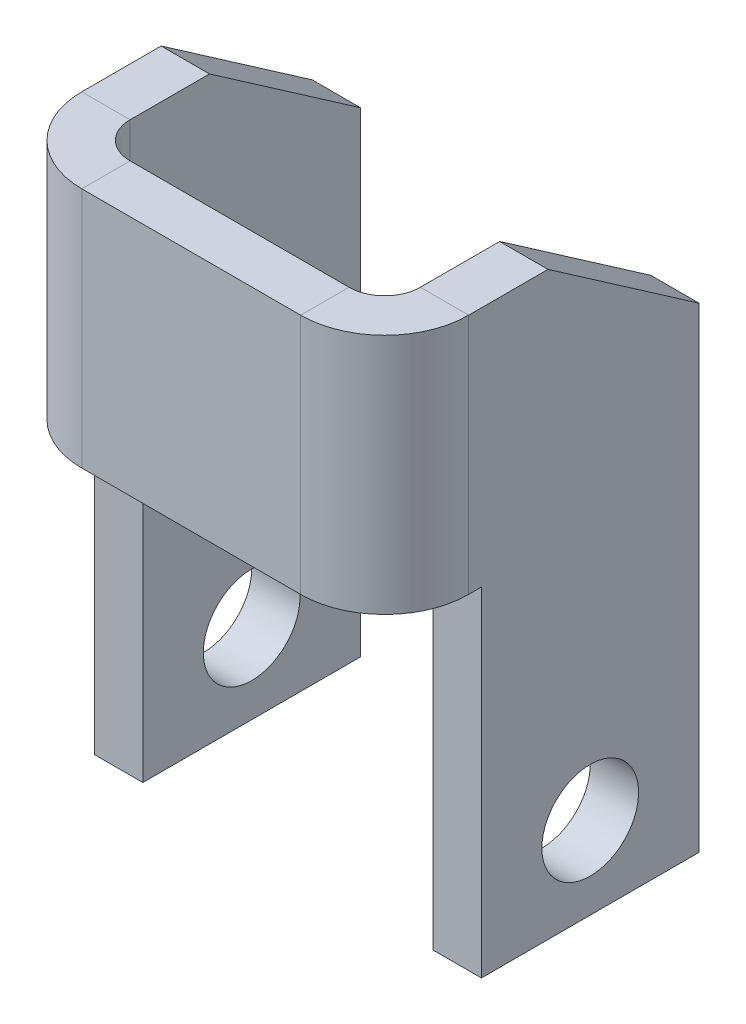
from build123d import *

# Parameters (mm, degrees)
CROQUIS1_W                         = 8
CROQUIS1_H                         = 21
BRIDA_BASE1_DEPTH                  = 1
BRIDA_DE_ARISTA1_STRIP_W           = 5.4732
BRIDA_DE_ARISTA1_STRIP_H           = 1
BRIDA_DE_ARISTA1_STRIP_CUT_DEPTH   = 21
BRIDA_DE_ARISTA1_STRIP_2_W         = 5.4732
BRIDA_DE_ARISTA1_STRIP_2_H         = 1
BRIDA_DE_ARISTA1_STRIP_CUT_2_DEPTH = 21
BRIDA_DE_ARISTA1_DEPTH             = 21
BRIDA_DE_ARISTA1_BEND_DEPTH        = 21
CROQUIS34_W                        = 2
CROQUIS34_H                        = 7
CORTAR_EXTRUIR1_DEPTH              = 10
CORTAR_EXTRUIR2_REACH              = 16.714
CROQUIS35_R                        = 1
CORTAR_EXTRUIR3_DEPTH              = 10


# Sheet-metal steps are written as plain solids
with BuildPart() as part:
    # Croquis1 → Brida base1 (new body)
    with BuildSketch(Plane.XY):
        Rectangle(CROQUIS1_W, CROQUIS1_H)
    extrude(amount=-BRIDA_BASE1_DEPTH)

    # Brida de arista1 strip (across the edge) → Brida de arista1 strip cut (cut)
    with BuildSketch(Plane(origin=(-4, -10.5, -1), x_dir=(1, 0, 0), z_dir=(0, 1, 0))):
        with Locations((-1, -0.5)):
            Rectangle(BRIDA_DE_ARISTA1_STRIP_W, BRIDA_DE_ARISTA1_STRIP_H)
    extrude(amount=BRIDA_DE_ARISTA1_STRIP_CUT_DEPTH, mode=Mode.SUBTRACT)

    # Brida de arista1 strip 2 (across the edge) → Brida de arista1 strip cut 2 (cut)
    with BuildSketch(Plane(origin=(4, 10.5, -1), x_dir=(-1, 0, 0), z_dir=(0, -1, 0))):
        with Locations((-1, -0.5)):
            Rectangle(BRIDA_DE_ARISTA1_STRIP_2_W, BRIDA_DE_ARISTA1_STRIP_2_H)
    extrude(amount=BRIDA_DE_ARISTA1_STRIP_CUT_2_DEPTH, mode=Mode.SUBTRACT)

    # Brida de arista1 section (across the edge) → Brida de arista1 (add)
    with BuildSketch(Plane(origin=(-4, -10.5, -1), x_dir=(1, 0, 0), z_dir=(0, 1, 0))):
        with BuildLine():
            Line((0, 0.7366), (0, 5.5))
            Line((0, 5.5), (1, 5.5))
            Line((1, 5.5), (1, 0.7366))
            ThreePointArc((1, 0.7366), (1.215745145, 0.215745145), (1.7366, 0))
            Line((1.7366, 0), (1.7366, -1))
            ThreePointArc((1.7366, -1), (0.508638364, -0.491361636), (0, 0.7366))
        make_face()
    extrude(amount=BRIDA_DE_ARISTA1_DEPTH)

    # Brida de arista1 section 2 (across the edge) → Brida de arista1 bend (add)
    with BuildSketch(Plane(origin=(4, 10.5, -1), x_dir=(-1, 0, 0), z_dir=(0, -1, 0))):
        with BuildLine():
            Line((0, 0.7366), (0, 5.5))
            Line((0, 5.5), (1, 5.5))
            Line((1, 5.5), (1, 0.7366))
            ThreePointArc((1, 0.7366), (1.215745145, 0.215745145), (1.7366, 0))
            Line((1.7366, 0), (1.7366, -1))
            ThreePointArc((1.7366, -1), (0.508638364, -0.491361636), (0, 0.7366))
        make_face()
    extrude(amount=BRIDA_DE_ARISTA1_BEND_DEPTH)

    # Croquis34 → Cortar-Extruir1 (cut)
    with BuildSketch(Plane(origin=(4, 0, 0), x_dir=(0, 0, -1), z_dir=(1, 0, 0))):
        with Locations((1, 7)):
            Rectangle(CROQUIS34_W, CROQUIS34_H)
        with Locations((1, -7)):
            Rectangle(CROQUIS34_W, CROQUIS34_H)
    extrude(amount=-CORTAR_EXTRUIR1_DEPTH, mode=Mode.SUBTRACT)

    # Cortar-Extruir2: up to this face of the body (flat: up to its plane)
    cortar_extruir2_end = Plane(part.part.faces().sort_by_distance((-4, 0, -4.204419709))[0])
    # Croquis35 → Cortar-Extruir2 (cut, up to the picked face)
    with BuildSketch(Plane(origin=(4, 0, 0), x_dir=(0, 0, -1), z_dir=(1, 0, 0)), mode=Mode.PRIVATE) as cortar_extruir2_sk1:
        with Locations((4.25, 8.8)):
            Circle(CROQUIS35_R)
    cortar_extruir2_tool1 = split(extrude(cortar_extruir2_sk1.sketch, amount=-CORTAR_EXTRUIR2_REACH, mode=Mode.PRIVATE), bisect_by=cortar_extruir2_end, keep=Keep.BOTH, mode=Mode.PRIVATE)
    # Croquis35 → Cortar-Extruir2 (cut, up to the picked face)
    with BuildSketch(Plane(origin=(4, 0, 0), x_dir=(0, 0, -1), z_dir=(1, 0, 0)), mode=Mode.PRIVATE) as cortar_extruir2_sk2:
        with Locations(Location((4.25, -8.8, 0), (0, 0, 180))):
            Circle(CROQUIS35_R)
    cortar_extruir2_tool2 = split(extrude(cortar_extruir2_sk2.sketch, amount=-CORTAR_EXTRUIR2_REACH, mode=Mode.PRIVATE), bisect_by=cortar_extruir2_end, keep=Keep.BOTH, mode=Mode.PRIVATE)
    add(cortar_extruir2_tool1.solids().sort_by(Axis((4, 8.8, -4.25), (-1, 0, 0)))[0], mode=Mode.SUBTRACT)
    add(cortar_extruir2_tool2.solids().sort_by(Axis((4, -8.8, -4.25), (-1, 0, 0)))[0], mode=Mode.SUBTRACT)

    # Croquis36 → Cortar-Extruir3 (cut)
    with BuildSketch(Plane(origin=(4, 0, 0), x_dir=(0, 0, -1), z_dir=(1, 0, 0))):
        Polygon((0, 1.5), (3.377527081, 1.5), (6.5, -0.666434932), (6.5, 11.157411488), (0, 11.157411488), align=None)
    extrude(amount=-CORTAR_EXTRUIR3_DEPTH, mode=Mode.SUBTRACT)


solid = part.part
